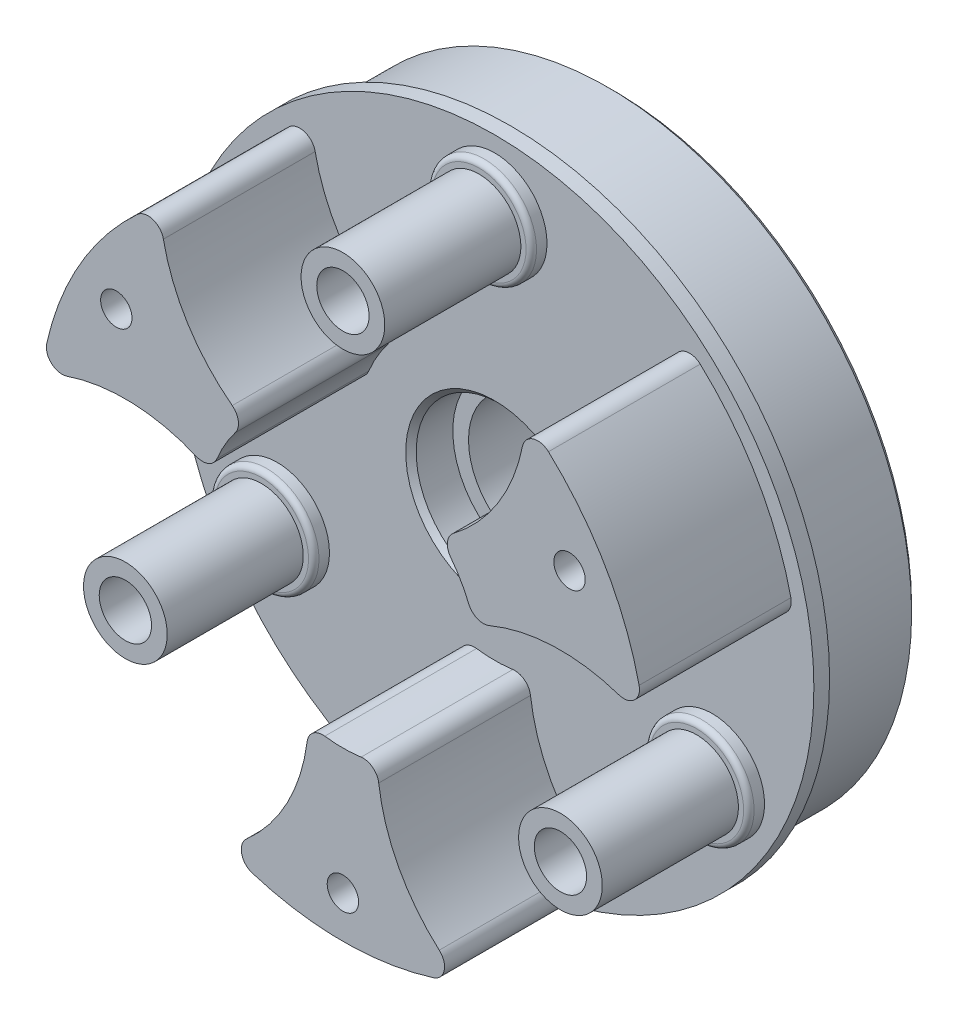
from build123d import *

# Parameters (mm, degrees)
SKETCH1_R                = 29
SKETCH1_R_2              = 2.5
BOSS_EXTRUDE1_DEPTH      = 11.34
SKETCH2_R                = 4
SKETCH2_R_2              = 2.5
BOSS_EXTRUDE2_DEPTH      = 14.5
SKETCH3_R                = 5
SKETCH3_R_2              = 4
BOSS_EXTRUDE3_DEPTH      = 1.5
BOSS_EXTRUDE4_DEPTH      = 14.5
FILLET2_R                = 0.5
FILLET5_R                = 1.5
CIRPATTERN1_COUNT        = 3
FILLET2_OF_CIRPATTERN1_R = 0.5
FILLET5_OF_CIRPATTERN1_R = 1.5
SKETCH5_R                = 1.5
CUT_EXTRUDE1_DEPTH       = 49.473761975
SKETCH6_R                = 2.75
CUT_EXTRUDE2_DEPTH       = 3
SKETCH7_R                = 4.25
CUT_EXTRUDE3_DEPTH       = 5
CIRPATTERN2_COUNT        = 3
CHAMFER1_SIZE            = 0.5
SKETCH9_R                = 8
CUT_EXTRUDE4_DEPTH       = 44.5
BOSS_EXTRUDE7_START      = -7.34
SKETCH10_R               = 8
SKETCH10_R_2             = 6.5
BOSS_EXTRUDE7_DEPTH      = 7.34
CHAMFER2_SIZE            = 0.5
BOSS_EXTRUDE8_START      = -1.5
SKETCH11_R               = 30.5
SKETCH11_R_2             = 29
BOSS_EXTRUDE8_DEPTH      = 1.5


with BuildPart() as part:
    # Sketch1 → Boss-Extrude1 (new body)
    with BuildSketch(Plane.XY):
        with Locations(Location((0, 0, 0), (0, 0, 180))):
            Circle(SKETCH1_R)
        with Locations(Location((0, 24, 0), (0, 0, 180))):
            Circle(SKETCH1_R_2, mode=Mode.SUBTRACT)
        with Locations(Location((20.784609691, -12, 0), (0, 0, 180))):
            Circle(SKETCH1_R_2, mode=Mode.SUBTRACT)
        with Locations(Location((-20.784609691, -12, 0), (0, 0, 180))):
            Circle(SKETCH1_R_2, mode=Mode.SUBTRACT)
    extrude(amount=BOSS_EXTRUDE1_DEPTH)

    # Sketch2 → Boss-Extrude2 (add)
    with BuildSketch(Plane.XY.offset(11.34)):
        with Locations(Location((0, 24, 0), (0, 0, 180))):
            Circle(SKETCH2_R)
        with Locations(Location((0, 24, 0), (0, 0, 180))):
            Circle(SKETCH2_R_2, mode=Mode.SUBTRACT)
    boss_extrude2 = extrude(amount=BOSS_EXTRUDE2_DEPTH)

    # Sketch3 → Boss-Extrude3 (add)
    with BuildSketch(Plane.XY.offset(11.34)):
        with Locations(Location((0, 24, 0), (0, 0, 90))):
            Circle(SKETCH3_R)
        with Locations(Location((0, 24, 0), (0, 0, 180))):
            Circle(SKETCH3_R_2, mode=Mode.SUBTRACT)
    boss_extrude3 = extrude(amount=BOSS_EXTRUDE3_DEPTH)

    # Sketch4 → Boss-Extrude4 (add)
    with BuildSketch(Plane.XY.offset(11.34)):
        with BuildLine():
            ThreePointArc((-9.243861456, 9.140625), (-15.08397544, 15.127363136), (-17.478886538, 23.140625))
            ThreePointArc((-17.478886538, 23.140625), (-25.11473671, 14.5), (-28.779812378, 3.566847272))
            ThreePointArc((-28.779812378, 3.566847272), (-20.642668488, 5.499424353), (-12.537944184, 3.43510635))
            ThreePointArc((-12.537944184, 3.43510635), (-11.258330249, 6.5), (-9.243861456, 9.140625))
        make_face()
    boss_extrude4 = extrude(amount=BOSS_EXTRUDE4_DEPTH)

    # Fillet2
    fillet2_edges = [part.edges().sort_by_distance(p)[0] for p in [
        (0, 19, 12.84),
    ]]
    fillet(fillet2_edges, radius=FILLET2_R)

    # Fillet5
    # the kernel refuses this fillet: 1.5 mm, written as the material it takes off along each edge
    with BuildSketch(Plane(origin=(-17.478886538, 23.140625, 11.34), x_dir=(0.12399934101480344, -0.9922823002693812, 0), z_dir=(0, 0, 1))) as fillet5_piece_1:
        with BuildLine():
            CenterArc((2.741938005, -1.495761572), FILLET5_R, 94.30820856, 121.194344996)
            ThreePointArc((1.52080355, -2.36687043), (0.731683032, -1.201888091), (0, 0))
            ThreePointArc((0, 0), (1.314627811, -0.049448326), (2.629255621, 0))
        make_face()
    extrude(amount=21.53336649, mode=Mode.SUBTRACT)
    with BuildSketch(Plane(origin=(-28.779812378, 3.566847272, 11.34), x_dir=(0.9213413502663426, 0.3887545707633453, 0), z_dir=(0, 0, 1))) as fillet5_piece_2:
        with BuildLine():
            CenterArc((2.741938005, 1.495761572), FILLET5_R, 144.497446444, 121.194344996)
            ThreePointArc((1.52080355, 2.36687043), (0.731683032, 1.201888091), (0, 0))
            ThreePointArc((0, 0), (1.314627811, 0.049448326), (2.629255621, 0))
        make_face()
    extrude(amount=21.53336649, mode=Mode.SUBTRACT)
    with BuildSketch(Plane(origin=(-12.537944184, 3.43510635, 11.34), x_dir=(-0.9027827871570022, 0.430096778891722, 0), z_dir=(0, 0, 1))) as fillet5_piece_3:
        with BuildLine():
            CenterArc((1.681832709, -1.498406794), FILLET5_R, 92.640987591, 90.493935252)
            ThreePointArc((0.184077424, -1.580437939), (0.116240905, -0.787400081), (0, 0))
            ThreePointArc((0, 0), (0.806358148, -0.018587399), (1.612716296, 0))
        make_face()
    extrude(amount=18.53179074, mode=Mode.SUBTRACT)
    with BuildSketch(Plane(origin=(-9.243861456, 9.140625, 11.34), x_dir=(-0.6582920213979585, -0.7527626548679136, 0), z_dir=(0, 0, 1))) as fillet5_piece_4:
        with BuildLine():
            CenterArc((1.682917286, -1.497188561), FILLET5_R, 93.508521646, 90.493935252)
            ThreePointArc((0.186575699, -1.601887437), (0.11175044, -0.798793336), (0, 0))
            ThreePointArc((0, 0), (0.795560899, -0.024365801), (1.591121798, 0))
        make_face()
    extrude(amount=18.53179074, mode=Mode.SUBTRACT)

    # CirPattern1: Boss-Extrude2, Boss-Extrude3, Boss-Extrude4 ×3 about axis
    cirpattern1_axis = Axis((0, 0, 0), (0, 0, 1))
    add([boss_extrude2.rotate(cirpattern1_axis, i * 360 / CIRPATTERN1_COUNT) for i in range(1, CIRPATTERN1_COUNT)])
    add([boss_extrude3.rotate(cirpattern1_axis, i * 360 / CIRPATTERN1_COUNT) for i in range(1, CIRPATTERN1_COUNT)])
    add([boss_extrude4.rotate(cirpattern1_axis, i * 360 / CIRPATTERN1_COUNT) for i in range(1, CIRPATTERN1_COUNT)])

    # Fillet2 of CirPattern1
    fillet2_of_cirpattern1_edges = [part.edges().sort_by_distance(p)[0] for p in [
        (-16.454482672, -9.5, 12.84),
        (16.454482672, -9.5, 12.84),
    ]]
    fillet(fillet2_of_cirpattern1_edges, radius=FILLET2_OF_CIRPATTERN1_R)

    # Fillet5 of CirPattern1
    # the kernel refuses this fillet: 1.5 mm, written as the material it takes off along each edge
    with BuildSketch(Plane(origin=(-11.30092584, -26.707472272, 11.34), x_dir=(0.9387654185354608, -0.3445569458913013, 0), z_dir=(0, 0, 1))) as fillet5_of_cirpattern1_piece_1:
        with BuildLine():
            CenterArc((2.740587632, 1.498234339), FILLET5_OF_CIRPATTERN1_R, 151.58593368, 121.194344996)
            ThreePointArc((1.421289964, 2.211994566), (0.752245893, 1.079267128), (0, 0))
            ThreePointArc((0, 0), (1.406673298, -0.034136121), (2.813346596, 0))
        make_face()
    extrude(amount=21.53336649, mode=Mode.SUBTRACT)
    with BuildSketch(Plane(origin=(11.30092584, -26.707472272, 11.34), x_dir=(-0.9387654185354388, -0.3445569458913611, 0), z_dir=(0, 0, 1))) as fillet5_of_cirpattern1_piece_2:
        with BuildLine():
            CenterArc((2.740587632, -1.498234339), FILLET5_OF_CIRPATTERN1_R, 87.219721325, 121.194344996)
            ThreePointArc((1.421289964, -2.211994566), (0.752245893, -1.079267128), (0, 0))
            ThreePointArc((0, 0), (1.406673298, 0.034136121), (2.813346596, 0))
        make_face()
    extrude(amount=21.53336649, mode=Mode.SUBTRACT)
    with BuildSketch(Plane(origin=(3.294082729, -12.57573135, 11.34), x_dir=(0.07891665697240977, -0.9968812172231449, 0), z_dir=(0, 0, 1)), Plane(origin=(9.243861456, 9.140625, 11.34), x_dir=(0.823866130184591, 0.5667844383314229, 0), z_dir=(0, 0, 1))) as fillet5_of_cirpattern1_piece_3:
        with BuildLine():
            CenterArc((1.681832709, -1.498406794), FILLET5_OF_CIRPATTERN1_R, 92.640987591, 90.493935252)
            ThreePointArc((0.184077424, -1.580437939), (0.116240905, -0.787400081), (0, 0))
            ThreePointArc((0, 0), (0.806358148, -0.018587399), (1.612716296, 0))
        make_face()
    extrude(amount=18.53179074, mode=Mode.SUBTRACT)
    with BuildSketch(Plane(origin=(-3.294082729, -12.57573135, 11.34), x_dir=(0.9810575928348104, -0.19371628620528378, 0), z_dir=(0, 0, 1)), Plane(origin=(12.537944184, 3.43510635, 11.34), x_dir=(-0.3227655714368486, 0.9464789410731993, 0), z_dir=(0, 0, 1))) as fillet5_of_cirpattern1_piece_4:
        with BuildLine():
            CenterArc((1.682917286, -1.497188561), FILLET5_OF_CIRPATTERN1_R, 93.508521646, 90.493935252)
            ThreePointArc((0.186575699, -1.601887437), (0.11175044, -0.798793336), (0, 0))
            ThreePointArc((0, 0), (0.795560899, -0.024365801), (1.591121798, 0))
        make_face()
    extrude(amount=18.53179074, mode=Mode.SUBTRACT)
    with BuildSketch(Plane(origin=(28.779812378, 3.566847272, 11.34), x_dir=(-0.9213413502663421, 0.38875457076334596, 0), z_dir=(0, 0, 1))) as fillet5_of_cirpattern1_piece_5:
        with BuildLine():
            CenterArc((2.741938005, -1.495761572), FILLET5_OF_CIRPATTERN1_R, 94.30820856, 121.194344996)
            ThreePointArc((1.52080355, -2.36687043), (0.731683032, -1.201888091), (0, 0))
            ThreePointArc((0, 0), (1.314627811, -0.049448326), (2.629255621, 0))
        make_face()
    extrude(amount=21.53336649, mode=Mode.SUBTRACT)
    with BuildSketch(Plane(origin=(17.478886538, 23.140625, 11.34), x_dir=(-0.12399934101479214, -0.9922823002693827, 0), z_dir=(0, 0, 1))) as fillet5_of_cirpattern1_piece_6:
        with BuildLine():
            CenterArc((2.741938005, 1.495761572), FILLET5_OF_CIRPATTERN1_R, 144.497446444, 121.194344996)
            ThreePointArc((1.52080355, 2.36687043), (0.731683032, 1.201888091), (0, 0))
            ThreePointArc((0, 0), (1.314627811, 0.049448326), (2.629255621, 0))
        make_face()
    extrude(amount=21.53336649, mode=Mode.SUBTRACT)

    # Sketch5 → Cut-Extrude1 (cut, through all)
    with BuildSketch(Plane.XY.offset(25.84)):
        with Locations((-21.650635095, 12.5)):
            Circle(SKETCH5_R)
    cut_extrude1 = extrude(amount=-CUT_EXTRUDE1_DEPTH, mode=Mode.SUBTRACT)

    # Sketch6 → Cut-Extrude2 (cut)
    with BuildSketch(Plane(origin=(0, 0, 0), x_dir=(-1, 0, 0), z_dir=(0, 0, -1))):
        with Locations((21.650635095, 12.5)):
            Circle(SKETCH6_R)
    cut_extrude2 = extrude(amount=-CUT_EXTRUDE2_DEPTH, mode=Mode.SUBTRACT)

    # Sketch7 → Cut-Extrude3 (cut)
    with BuildSketch(Plane(origin=(0, 0, 0), x_dir=(-1, 0, 0), z_dir=(0, 0, -1))):
        with Locations((0, 24)):
            Circle(SKETCH7_R)
    cut_extrude3 = extrude(amount=-CUT_EXTRUDE3_DEPTH, mode=Mode.SUBTRACT)

    # CirPattern2: Cut-Extrude1, Cut-Extrude2, Cut-Extrude3 ×3 about axis
    cirpattern2_axis = Axis((0, 0, 0), (0, 0, 1))
    add([cut_extrude1.rotate(cirpattern2_axis, i * 360 / CIRPATTERN2_COUNT) for i in range(1, CIRPATTERN2_COUNT)], mode=Mode.SUBTRACT)
    add([cut_extrude2.rotate(cirpattern2_axis, i * 360 / CIRPATTERN2_COUNT) for i in range(1, CIRPATTERN2_COUNT)], mode=Mode.SUBTRACT)
    add([cut_extrude3.rotate(cirpattern2_axis, i * 360 / CIRPATTERN2_COUNT) for i in range(1, CIRPATTERN2_COUNT)], mode=Mode.SUBTRACT)

    # Chamfer1
    chamfer1_edges = [part.edges().sort_by_distance(p)[0] for p in [
        (29, 0, 0),
    ]]
    chamfer(chamfer1_edges, length=CHAMFER1_SIZE)

    # Sketch9 → Cut-Extrude4 (cut, through all)
    with BuildSketch(Plane.XY.offset(11.34)):
        Circle(SKETCH9_R)
    extrude(amount=-CUT_EXTRUDE4_DEPTH, mode=Mode.SUBTRACT)

    # Sketch10 → Boss-Extrude7 (add)
    with BuildSketch(Plane(origin=(0, 0, 0), x_dir=(-1, 0, 0), z_dir=(0, 0, -1)).offset(BOSS_EXTRUDE7_START)):
        with Locations(Location((0, 0, 0), (0, 0, 180))):
            Circle(SKETCH10_R)
        Circle(SKETCH10_R_2, mode=Mode.SUBTRACT)
    extrude(amount=BOSS_EXTRUDE7_DEPTH)

    # Chamfer2
    chamfer2_edges = [part.edges().sort_by_distance(p)[0] for p in [
        (-8, 0, 11.34),
    ]]
    chamfer(chamfer2_edges, length=CHAMFER2_SIZE)

    # Sketch11 → Boss-Extrude8 (add)
    with BuildSketch(Plane.XY.offset(11.34).offset(BOSS_EXTRUDE8_START)):
        Circle(SKETCH11_R)
        with Locations(Location((0, 0, 0), (0, 0, 180))):
            Circle(SKETCH11_R_2, mode=Mode.SUBTRACT)
    extrude(amount=BOSS_EXTRUDE8_DEPTH)


solid = part.part
